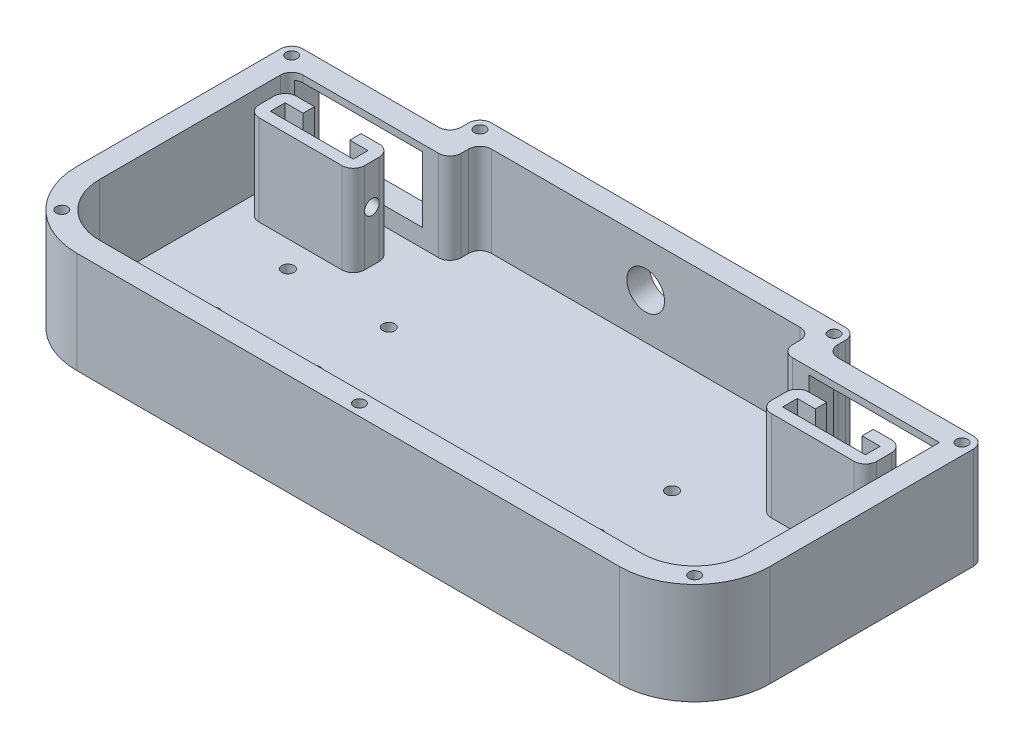
from build123d import *

# Parameters (mm, degrees)
BOSS_EXTRUDE1_DEPTH = 3
SKETCH1_9_R         = 1.5
SKETCH1_9_W         = 3
SKETCH1_9_H         = 3.9
SKETCH1_9_W_2       = 7.8
SKETCH1_9_H_2       = 3
BOSS_EXTRUDE2_DEPTH = 27
SKETCH2_W           = 22
SKETCH2_H           = 3.9
BOSS_EXTRUDE3_DEPTH = 2.5
CUT_EXTRUDE1_REACH  = 183.139
SKETCH6_R           = 1.95
SKETCH1_12_R        = 1.6
CUT_EXTRUDE7_DEPTH  = 105.877309271
SKETCH7_R           = 5
CUT_EXTRUDE8_DEPTH  = 10
FILLET1_R           = 3
FILLET2_R           = 3
CUT_EXTRUDE9_START  = -7.3
SKETCH8_W           = 11.4
SKETCH8_H           = 17.4
CUT_EXTRUDE9_DEPTH  = 33.4


with BuildPart() as part:
    # Sketch1 → Boss-Extrude1 (new body)
    with BuildSketch(Plane(origin=(0, 0, 0), x_dir=(1, 0, 0), z_dir=(0, 1, 0))):
        with BuildLine():
            ThreePointArc((-92, -22.5), (-86.142135624, -36.642135624), (-72, -42.5))
            Line((-72, -42.5), (72, -42.5))
            ThreePointArc((72, -42.5), (86.142135624, -36.642135624), (92, -22.5))
            Line((92, -22.5), (92, 34.5))
            Line((92, 34.5), (50, 34.5))
            Line((50, 34.5), (50, 42.5))
            Line((50, 42.5), (-50, 42.5))
            Line((-50, 42.5), (-50, 34.5))
            Line((-50, 34.5), (-92, 34.5))
            Line((-92, 34.5), (-92, -22.5))
        make_face()
    extrude(amount=BOSS_EXTRUDE1_DEPTH)

    # Sketch1<9> → Boss-Extrude2 (add)
    # profile 1 of 13: a face of its own
    with BuildSketch(Plane(origin=(0, 0, 0), x_dir=(1, 0, 0), z_dir=(0, 1, 0))):
        with BuildLine():
            ThreePointArc((-92, -22.5), (-86.142135624, -36.642135624), (-72, -42.5))
            Line((-72, -42.5), (72, -42.5))
            ThreePointArc((72, -42.5), (86.142135624, -36.642135624), (92, -22.5))
            Line((92, -22.5), (92, 34.5))
            Line((92, 34.5), (50, 34.5))
            Line((50, 34.5), (50, 42.5))
            Line((50, 42.5), (-50, 42.5))
            Line((-50, 42.5), (-50, 34.5))
            Line((-50, 34.5), (-92, 34.5))
            Line((-92, 34.5), (-92, -22.5))
        make_face()
        with Locations(Location((0, -39.5, 0), (0, 0, 270))):
            Circle(SKETCH1_9_R, mode=Mode.SUBTRACT)
        with Locations(Location((-89, 31.5, 0), (0, 0, 270))):
            Circle(SKETCH1_9_R, mode=Mode.SUBTRACT)
        with Locations(Location((-47, 39.5, 0), (0, 0, 270))):
            Circle(SKETCH1_9_R, mode=Mode.SUBTRACT)
        Polygon((-72, -36.5), (-86, -36.5), (-86, -22.5), (-86, 28.5), (-44, 28.5), (-44, 36.5), (44, 36.5), (44, 28.5), (86, 28.5), (86, -22.5), (86, -36.5), (72, -36.5), align=None, mode=Mode.SUBTRACT)
        with Locations(Location((89, 31.5, 0), (0, 0, 270))):
            Circle(SKETCH1_9_R, mode=Mode.SUBTRACT)
        with Locations(Location((47, 39.5, 0), (0, 0, 270))):
            Circle(SKETCH1_9_R, mode=Mode.SUBTRACT)
    # profile 2 of 13: a face of its own
    with BuildSketch(Plane(origin=(0, 0, 0), x_dir=(1, 0, 0), z_dir=(0, 1, 0))):
        Polygon((-57, 19.75), (-54, 19.75), (-54, 22.75), (-61.8, 22.75), (-61.8, 19.75), align=None)
    # profile 3 of 13: a face of its own
    with BuildSketch(Plane(origin=(0, 0, 0), x_dir=(1, 0, 0), z_dir=(0, 1, 0))):
        with Locations((-55.5, 17.8)):
            Rectangle(SKETCH1_9_W, SKETCH1_9_H)
    # profile 4 of 13: a face of its own
    with BuildSketch(Plane(origin=(0, 0, 0), x_dir=(1, 0, 0), z_dir=(0, 1, 0))):
        Polygon((-54, 12.85), (-54, 15.85), (-57, 15.85), (-79, 15.85), (-79, 12.85), align=None)
    # profile 5 of 13: a face of its own
    with BuildSketch(Plane(origin=(0, 0, 0), x_dir=(1, 0, 0), z_dir=(0, 1, 0))):
        Polygon((-82, 19.75), (-79, 19.75), (-74.2, 19.75), (-74.2, 22.75), (-82, 22.75), align=None)
    # profile 6 of 13: a face of its own
    with BuildSketch(Plane(origin=(0, 0, 0), x_dir=(1, 0, 0), z_dir=(0, 1, 0))):
        Polygon((-79, 12.85), (-79, 15.85), (-79, 19.75), (-82, 19.75), (-82, 12.85), align=None)
    # profile 7 of 13: a face of its own
    with BuildSketch(Plane(origin=(0, 0, 0), x_dir=(1, 0, 0), z_dir=(0, 1, 0))):
        with Locations((57.9, 21.25)):
            Rectangle(SKETCH1_9_W_2, SKETCH1_9_H_2)
    # profile 8 of 13: a face of its own
    with BuildSketch(Plane(origin=(0, 0, 0), x_dir=(1, 0, 0), z_dir=(0, 1, 0))):
        with Locations((55.5, 17.8)):
            Rectangle(SKETCH1_9_W, SKETCH1_9_H)
    # profile 9 of 13: a face of its own
    with BuildSketch(Plane(origin=(0, 0, 0), x_dir=(1, 0, 0), z_dir=(0, 1, 0))):
        Polygon((79, 15.85), (57, 15.85), (54, 15.85), (54, 12.85), (79, 12.85), align=None)
    # profile 10 of 13: a face of its own
    with BuildSketch(Plane(origin=(0, 0, 0), x_dir=(1, 0, 0), z_dir=(0, 1, 0))):
        with Locations((78.1, 21.25)):
            Rectangle(SKETCH1_9_W_2, SKETCH1_9_H_2)
    # profile 11 of 13: a face of its own
    with BuildSketch(Plane(origin=(0, 0, 0), x_dir=(1, 0, 0), z_dir=(0, 1, 0))):
        Polygon((79, 19.75), (79, 15.85), (79, 12.85), (82, 12.85), (82, 19.75), align=None)
    # profile 12 of 13: a face of its own
    with BuildSketch(Plane(origin=(0, 0, 0), x_dir=(1, 0, 0), z_dir=(0, 1, 0))):
        with BuildLine():
            Line((-86, -22.5), (-86, -36.5))
            Line((-86, -36.5), (-72, -36.5))
            ThreePointArc((-72, -36.5), (-81.899494937, -32.399494937), (-86, -22.5))
        make_face()
        with Locations(Location((-84.02081528, -34.52081528, 0), (0, 0, 270))):
            Circle(SKETCH1_9_R, mode=Mode.SUBTRACT)
    # profile 13 of 13: a face of its own
    with BuildSketch(Plane(origin=(0, 0, 0), x_dir=(1, 0, 0), z_dir=(0, 1, 0))):
        with BuildLine():
            ThreePointArc((86, -22.5), (81.899494937, -32.399494937), (72, -36.5))
            Line((72, -36.5), (86, -36.5))
            Line((86, -36.5), (86, -22.5))
        make_face()
        with Locations(Location((84.02081528, -34.52081528, 0), (0, 0, 270))):
            Circle(SKETCH1_9_R, mode=Mode.SUBTRACT)
    extrude(amount=BOSS_EXTRUDE2_DEPTH)

    # Sketch2 → Boss-Extrude3 (add)
    with BuildSketch(Plane(origin=(0, 3, 0), x_dir=(1, 0, 0), z_dir=(0, 1, 0))):
        with Locations((-68, 17.8)):
            Rectangle(SKETCH2_W, SKETCH2_H)
        with Locations((68, 17.8)):
            Rectangle(SKETCH2_W, SKETCH2_H)
    extrude(amount=BOSS_EXTRUDE3_DEPTH)

    # Cut-Extrude1: up to this face of the body (flat: up to its plane)
    cut_extrude1_end = Plane(part.part.faces().sort_by_distance((82, 15, -17.8))[0])
    # Sketch6 → Cut-Extrude1 (cut, up to the picked face)
    with BuildSketch(Plane.ZY.offset(82), mode=Mode.PRIVATE) as cut_extrude1_sk1:
        with Locations((-17.8, 16.5)):
            Circle(SKETCH6_R)
    cut_extrude1_tool1 = split(extrude(cut_extrude1_sk1.sketch, amount=-CUT_EXTRUDE1_REACH, mode=Mode.PRIVATE), bisect_by=cut_extrude1_end, keep=Keep.BOTH, mode=Mode.PRIVATE)
    add(cut_extrude1_tool1.solids().sort_by(Axis((-82, 16.5, -17.8), (1, 0, 0)))[0], mode=Mode.SUBTRACT)

    # Sketch1<12> → Cut-Extrude7 (cut, through all)
    with BuildSketch(Plane(origin=(0, 0, 0), x_dir=(1, 0, 0), z_dir=(0, 1, 0))):
        with Locations(Location((-64.4, -13.9, 0), (0, 0, 270))):
            Circle(SKETCH1_12_R)
        with Locations(Location((-37.6, -13.9, 0), (0, 0, 270))):
            Circle(SKETCH1_12_R)
        with Locations(Location((64.4, 5.9, 0), (0, 0, 270))):
            Circle(SKETCH1_12_R)
        with Locations(Location((37.6, 5.9, 0), (0, 0, 270))):
            Circle(SKETCH1_12_R)
        with Locations(Location((64.4, -13.9, 0), (0, 0, 270))):
            Circle(SKETCH1_12_R)
        with Locations(Location((37.6, -13.9, 0), (0, 0, 270))):
            Circle(SKETCH1_12_R)
        with Locations(Location((-64.4, 5.9, 0), (0, 0, 270))):
            Circle(SKETCH1_12_R)
        with Locations(Location((-37.6, 5.9, 0), (0, 0, 270))):
            Circle(SKETCH1_12_R)
    extrude(amount=CUT_EXTRUDE7_DEPTH, mode=Mode.SUBTRACT)

    # Sketch7 → Cut-Extrude8 (cut)
    with BuildSketch(Plane(origin=(0, 0, -42.5), x_dir=(-1, 0, 0), z_dir=(0, 0, -1))):
        with Locations((0, 15)):
            Circle(SKETCH7_R)
    extrude(amount=-CUT_EXTRUDE8_DEPTH, mode=Mode.SUBTRACT)

    # Fillet1
    fillet1_edges = [part.edges().sort_by_distance(p)[0] for p in [
        (-86, 15, -28.5),
        (-44, 15, -28.5),
        (-44, 15, -36.5),
        (44, 15, -36.5),
        (44, 15, -28.5),
        (-92, 13.5, -34.5),
        (-50, 13.5, -34.5),
        (-50, 13.5, -42.5),
        (50, 13.5, -42.5),
        (50, 13.5, -34.5),
        (92, 13.5, -34.5),
    ]]
    fillet(fillet1_edges, radius=FILLET1_R)

    # Fillet2
    fillet2_edges = [part.edges().sort_by_distance(p)[0] for p in [
        (54, 15, -22.75),
        (54, 15, -12.85),
        (82, 15, -12.85),
        (82, 15, -22.75),
        (-82, 15, -22.75),
        (-82, 15, -12.85),
        (-54, 15, -12.85),
        (-54, 15, -22.75),
    ]]
    fillet(fillet2_edges, radius=FILLET2_R - 0.0001)  # a hair under: the kernel refuses the full size

    # Sketch8 → Cut-Extrude9 (cut)
    with BuildSketch(Plane.ZY.offset(92).offset(CUT_EXTRUDE9_START)):
        with Locations((-31.1, 16.5)):
            Rectangle(SKETCH8_W, SKETCH8_H)
    cut_extrude9 = extrude(amount=-CUT_EXTRUDE9_DEPTH, mode=Mode.SUBTRACT)

    # Mirror1: Cut-Extrude9 across plane
    add(cut_extrude9.mirror(Plane(origin=(0, 0, 0), x_dir=(0, 0, 1), z_dir=(1, 0, 0))), mode=Mode.SUBTRACT)


solid = part.part
